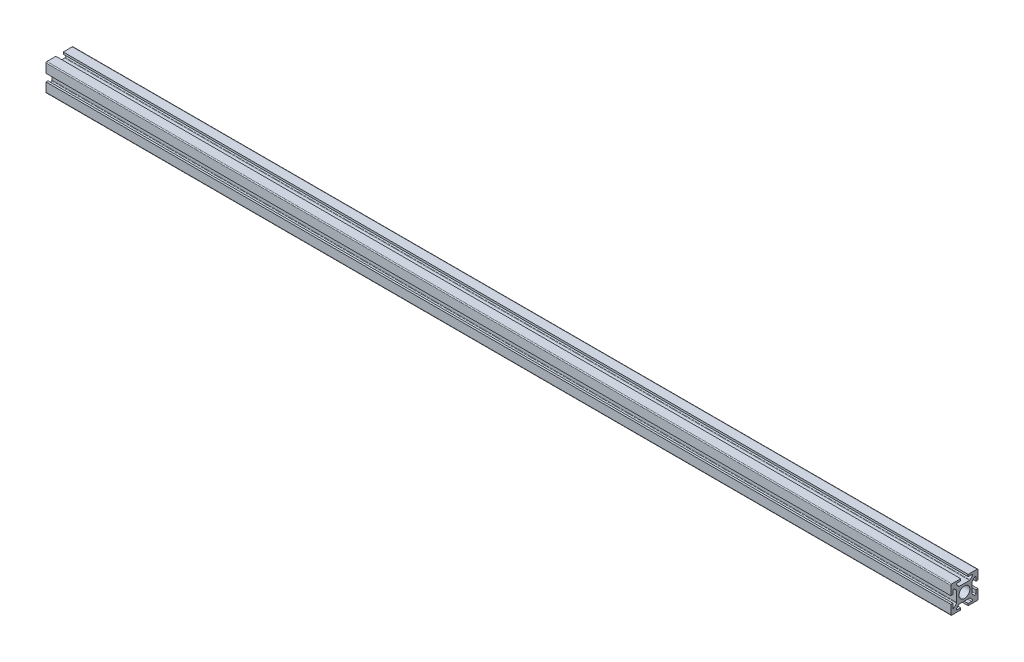
from build123d import *

# Parameters (mm, degrees)
BOSS_EXTRUDE2_DEPTH = 500
FILLET1_R           = 1
SKETCH2_R           = 6
CUT_EXTRUDE1_DEPTH  = 1001.224974693


with BuildPart() as part:
    # Sketch1 → Boss-Extrude2 (new, symmetric)
    with BuildSketch(Plane(origin=(0, 0, 0), x_dir=(0, 0, -1), z_dir=(1, 0, 0))):
        Polygon((-10.3, 12.8), (-6, 8.5), (6, 8.5), (10.3, 12.8), (4.1, 12.8), (4.1, 15), (15, 15), (15, 4.1), (12.8, 4.1), (12.8, 10.3), (8.5, 6), (8.5, -6), (12.8, -10.3), (12.8, -4.1), (15, -4.1), (15, -15), (4.1, -15), (4.1, -12.8), (10.3, -12.8), (6, -8.5), (-6, -8.5), (-10.3, -12.8), (-4.1, -12.8), (-4.1, -15), (-15, -15), (-15, -4.1), (-12.8, -4.1), (-12.8, -10.3), (-8.5, -6), (-8.5, 6), (-12.8, 10.3), (-12.8, 4.1), (-15, 4.1), (-15, 15), (-4.1, 15), (-4.1, 12.8), align=None)
    extrude(amount=BOSS_EXTRUDE2_DEPTH, both=True)

    # Fillet1
    fillet1_edges = [part.edges().sort_by_distance(p)[0] for p in [
        (0, 15, 15),
        (0, -6, -8.5),
        (0, 6, -8.5),
        (0, 10.3, -12.8),
        (0, -12.8, 10.3),
        (0, -12.8, -10.3),
        (0, -10.3, -12.8),
        (0, -15, -15),
        (0, -15, 15),
        (0, -6, 8.5),
        (0, -8.5, -6),
        (0, 6, 8.5),
        (0, 10.3, 12.8),
        (0, 15, -15),
        (0, 12.8, -10.3),
        (0, 8.5, -6),
        (0, 8.5, 6),
        (0, 12.8, 10.3),
    ]]
    fillet(fillet1_edges, radius=FILLET1_R)

    # Sketch2 → Cut-Extrude1 (cut, through all)
    with BuildSketch(Plane.ZY.offset(500)):
        Circle(SKETCH2_R)
    extrude(amount=-CUT_EXTRUDE1_DEPTH, mode=Mode.SUBTRACT)


solid = part.part
